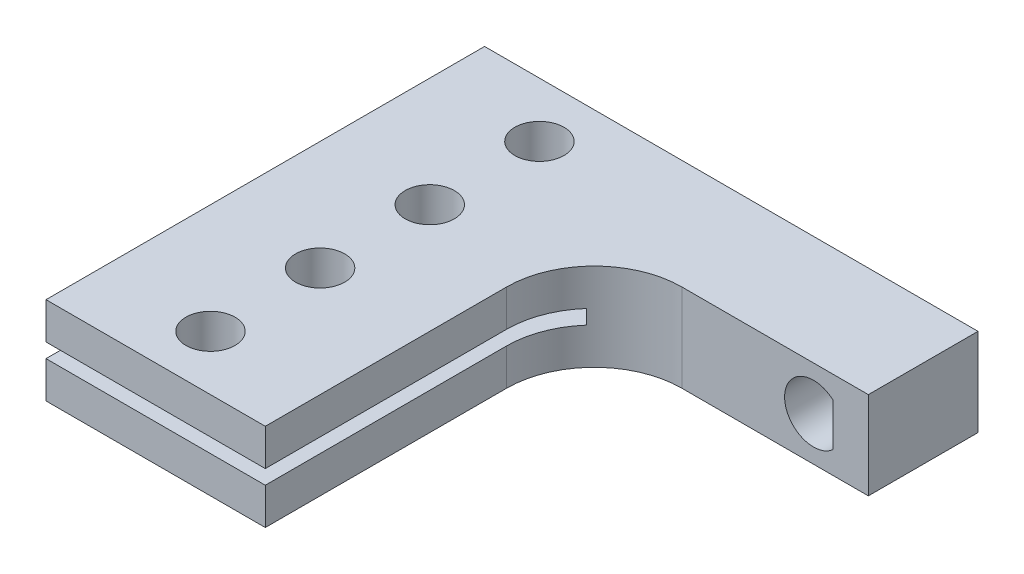
from build123d import *

# Parameters (mm, degrees)
BOSS_EXTRUDE1_DEPTH = 5.08
SKETCH2_W           = 25.4
SKETCH2_H           = 0.8334375
CUT_EXTRUDE1_DEPTH  = 13.97
SKETCH3_R           = 1.4224
CUT_EXTRUDE2_DEPTH  = 12.7
CUT_EXTRUDE3_DEPTH  = 12.7
FILLET3_R           = 5.08


with BuildPart() as part:
    # Sketch1 → Boss-Extrude1 (new body)
    with BuildSketch(Plane(origin=(0, 0, 0), x_dir=(1, 0, 0), z_dir=(0, 1, 0))):
        Polygon((-33.096969697, 5.387878788), (-20.396969697, 5.387878788), (-4.521969697, 5.387878788), (-4.521969697, -0.962121212), (-20.396969697, -0.962121212), (-20.396969697, -20.012121212), (-33.096969697, -20.012121212), align=None)
    extrude(amount=BOSS_EXTRUDE1_DEPTH)

    # Sketch2 → Cut-Extrude1 (cut)
    with BuildSketch(Plane.ZY.offset(33.096969697)):
        with Locations((7.312121212, 2.54)):
            Rectangle(SKETCH2_W, SKETCH2_H)
    extrude(amount=-CUT_EXTRUDE1_DEPTH, mode=Mode.SUBTRACT)

    # Sketch3 → Cut-Extrude2 (cut)
    with BuildSketch(Plane(origin=(0, 5.08, 0), x_dir=(1, 0, 0), z_dir=(0, 1, 0))):
        with Locations(Location((-26.746969697, -16.837121212, 0), (0, 0, 90))):
            Circle(SKETCH3_R)
        with Locations(Location((-26.746969697, -10.487121212, 0), (0, 0, 90))):
            Circle(SKETCH3_R)
        with Locations(Location((-26.746969697, -4.137121212, 0), (0, 0, 90))):
            Circle(SKETCH3_R)
        with Locations(Location((-26.746969697, 2.212878788, 0), (0, 0, 90))):
            Circle(SKETCH3_R)
    extrude(amount=-CUT_EXTRUDE2_DEPTH, mode=Mode.SUBTRACT)

    # Sketch5 → Cut-Extrude3 (cut)
    with BuildSketch(Plane.XY.offset(0.962121212)):
        with BuildLine():
            Line((-6.579369697, 1.290485214), (-6.579369697, 3.789514786))
            ThreePointArc((-6.579369697, 3.789514786), (-9.373369697, 2.54), (-6.579369697, 1.290485214))
        make_face()
    extrude(amount=-CUT_EXTRUDE3_DEPTH, mode=Mode.SUBTRACT)

    # Fillet3
    # the kernel refuses this fillet: 5.08 mm, written as the material it adds along each edge
    with BuildSketch(Plane(origin=(-20.396969697, -9.74328125, 0.962121212), x_dir=(1, 0, 0), z_dir=(0, 1, 0))) as fillet3_piece_1_section:
        with BuildLine():
            CenterArc((FILLET3_R, -FILLET3_R), FILLET3_R, 90, 90)
            Line((0, -FILLET3_R), (0, 0))
            Line((0, 0), (FILLET3_R, 0))
        make_face()
    fillet3_piece_1 = extrude(amount=14.82328125, mode=Mode.PRIVATE)
    fillet3_piece_1 = split(fillet3_piece_1, bisect_by=Plane(origin=(-18.050290176, 0, 1.370319311), z_dir=(0, 1, 0)), keep=Keep.TOP, mode=Mode.PRIVATE)
    fillet3_piece_1 = split(fillet3_piece_1, bisect_by=Plane(origin=(-18.050290176, 2.12328125, 1.370319311), z_dir=(0, -1, 0)), keep=Keep.TOP, mode=Mode.PRIVATE)
    fillet3_piece_1 = split(fillet3_piece_1, bisect_by=Plane(origin=(-19.126969697, 1.061640625, 1.370319311), z_dir=(1, 0, 0)), keep=Keep.TOP, mode=Mode.PRIVATE)
    add(fillet3_piece_1)
    with BuildSketch(Plane(origin=(-20.396969697, -9.74328125, 0.962121212), x_dir=(1, 0, 0), z_dir=(0, 1, 0))) as fillet3_piece_2_section:
        with BuildLine():
            CenterArc((FILLET3_R, -FILLET3_R), FILLET3_R, 90, 90)
            Line((0, -FILLET3_R), (0, 0))
            Line((0, 0), (FILLET3_R, 0))
        make_face()
    fillet3_piece_2 = extrude(amount=14.82328125, mode=Mode.PRIVATE)
    fillet3_piece_2 = split(fillet3_piece_2, bisect_by=Plane(origin=(-19.932991251, 0, 2.537596858), z_dir=(0, 1, 0)), keep=Keep.TOP, mode=Mode.PRIVATE)
    fillet3_piece_2 = split(fillet3_piece_2, bisect_by=Plane(origin=(-19.932991251, 2.12328125, 2.537596858), z_dir=(0, -1, 0)), keep=Keep.TOP, mode=Mode.PRIVATE)
    fillet3_piece_2 = split(fillet3_piece_2, bisect_by=Plane(origin=(-19.126969697, 1.061640625, 2.537596858), z_dir=(-1, 0, 0)), keep=Keep.TOP, mode=Mode.PRIVATE)
    add(fillet3_piece_2)
    with BuildSketch(Plane(origin=(-20.396969697, -9.74328125, 0.962121212), x_dir=(1, 0, 0), z_dir=(0, 1, 0))) as fillet3_piece_3_section:
        with BuildLine():
            CenterArc((FILLET3_R, -FILLET3_R), FILLET3_R, 90, 90)
            Line((0, -FILLET3_R), (0, 0))
            Line((0, 0), (FILLET3_R, 0))
        make_face()
    fillet3_piece_3 = extrude(amount=14.82328125, mode=Mode.PRIVATE)
    fillet3_piece_3 = split(fillet3_piece_3, bisect_by=Plane(origin=(-18.050290176, 2.12328125, 1.370319311), z_dir=(0, 1, 0)), keep=Keep.TOP, mode=Mode.PRIVATE)
    fillet3_piece_3 = split(fillet3_piece_3, bisect_by=Plane(origin=(-19.126969697, 2.54, 1.370319311), z_dir=(1, 0, 0)), keep=Keep.TOP, mode=Mode.PRIVATE)
    fillet3_piece_3 = split(fillet3_piece_3, bisect_by=Plane(origin=(-18.050290176, 2.95671875, 1.370319311), z_dir=(0, -1, 0)), keep=Keep.TOP, mode=Mode.PRIVATE)
    add(fillet3_piece_3)
    with BuildSketch(Plane(origin=(-20.396969697, 2.95671875, 0.962121212), x_dir=(1, 0, 0), z_dir=(0, 1, 0))) as fillet3_piece_4_section:
        with BuildLine():
            CenterArc((FILLET3_R, -FILLET3_R), FILLET3_R, 90, 90)
            Line((0, -FILLET3_R), (0, 0))
            Line((0, 0), (FILLET3_R, 0))
        make_face()
    fillet3_piece_4 = extrude(amount=2.12328125, mode=Mode.PRIVATE)
    fillet3_piece_4 = split(fillet3_piece_4, bisect_by=Plane(origin=(-19.126969697, 4.018359375, 1.370319311), z_dir=(1, 0, 0)), keep=Keep.TOP, mode=Mode.PRIVATE)
    add(fillet3_piece_4)
    with BuildSketch(Plane(origin=(-20.396969697, 2.95671875, 0.962121212), x_dir=(1, 0, 0), z_dir=(0, 1, 0))) as fillet3_piece_5_section:
        with BuildLine():
            CenterArc((FILLET3_R, -FILLET3_R), FILLET3_R, 90, 90)
            Line((0, -FILLET3_R), (0, 0))
            Line((0, 0), (FILLET3_R, 0))
        make_face()
    fillet3_piece_5 = extrude(amount=2.12328125, mode=Mode.PRIVATE)
    fillet3_piece_5 = split(fillet3_piece_5, bisect_by=Plane(origin=(-19.126969697, 4.018359375, 2.537596858), z_dir=(-1, 0, 0)), keep=Keep.TOP, mode=Mode.PRIVATE)
    add(fillet3_piece_5)
    with BuildSketch(Plane(origin=(-20.396969697, 0, 0.962121212), x_dir=(1, 0, 0), z_dir=(0, 1, 0))) as fillet3_piece_6_section:
        with BuildLine():
            CenterArc((FILLET3_R, -FILLET3_R), FILLET3_R, 90, 90)
            Line((0, -FILLET3_R), (0, 0))
            Line((0, 0), (FILLET3_R, 0))
        make_face()
    fillet3_piece_6 = extrude(amount=2.12328125, mode=Mode.PRIVATE)
    fillet3_piece_6 = split(fillet3_piece_6, bisect_by=Plane(origin=(-19.126969697, 1.061640625, 1.370319311), z_dir=(1, 0, 0)), keep=Keep.TOP, mode=Mode.PRIVATE)
    add(fillet3_piece_6)
    with BuildSketch(Plane(origin=(-20.396969697, 0, 0.962121212), x_dir=(1, 0, 0), z_dir=(0, 1, 0))) as fillet3_piece_7_section:
        with BuildLine():
            CenterArc((FILLET3_R, -FILLET3_R), FILLET3_R, 90, 90)
            Line((0, -FILLET3_R), (0, 0))
            Line((0, 0), (FILLET3_R, 0))
        make_face()
    fillet3_piece_7 = extrude(amount=2.12328125, mode=Mode.PRIVATE)
    fillet3_piece_7 = split(fillet3_piece_7, bisect_by=Plane(origin=(-19.126969697, 1.061640625, 2.537596858), z_dir=(-1, 0, 0)), keep=Keep.TOP, mode=Mode.PRIVATE)
    add(fillet3_piece_7)
    with BuildSketch(Plane(origin=(-20.396969697, 0, 0.962121212), x_dir=(1, 0, 0), z_dir=(0, 1, 0))) as fillet3_piece_8_section:
        with BuildLine():
            CenterArc((FILLET3_R, -FILLET3_R), FILLET3_R, 90, 90)
            Line((0, -FILLET3_R), (0, 0))
            Line((0, 0), (FILLET3_R, 0))
        make_face()
    fillet3_piece_8 = extrude(amount=14.82328125, mode=Mode.PRIVATE)
    fillet3_piece_8 = split(fillet3_piece_8, bisect_by=Plane(origin=(-18.050290176, 2.12328125, 1.370319311), z_dir=(0, 1, 0)), keep=Keep.TOP, mode=Mode.PRIVATE)
    fillet3_piece_8 = split(fillet3_piece_8, bisect_by=Plane(origin=(-19.126969697, 2.54, 1.370319311), z_dir=(1, 0, 0)), keep=Keep.TOP, mode=Mode.PRIVATE)
    fillet3_piece_8 = split(fillet3_piece_8, bisect_by=Plane(origin=(-18.050290176, 2.95671875, 1.370319311), z_dir=(0, -1, 0)), keep=Keep.TOP, mode=Mode.PRIVATE)
    add(fillet3_piece_8)
    with BuildSketch(Plane(origin=(-20.396969697, 0, 0.962121212), x_dir=(1, 0, 0), z_dir=(0, 1, 0))) as fillet3_piece_9_section:
        with BuildLine():
            CenterArc((FILLET3_R, -FILLET3_R), FILLET3_R, 90, 90)
            Line((0, -FILLET3_R), (0, 0))
            Line((0, 0), (FILLET3_R, 0))
        make_face()
    fillet3_piece_9 = extrude(amount=14.82328125, mode=Mode.PRIVATE)
    fillet3_piece_9 = split(fillet3_piece_9, bisect_by=Plane(origin=(-18.050290176, 5.08, 1.370319311), z_dir=(0, -1, 0)), keep=Keep.TOP, mode=Mode.PRIVATE)
    fillet3_piece_9 = split(fillet3_piece_9, bisect_by=Plane(origin=(-19.126969697, 4.018359375, 1.370319311), z_dir=(1, 0, 0)), keep=Keep.TOP, mode=Mode.PRIVATE)
    fillet3_piece_9 = split(fillet3_piece_9, bisect_by=Plane(origin=(-18.050290176, 2.95671875, 1.370319311), z_dir=(0, 1, 0)), keep=Keep.TOP, mode=Mode.PRIVATE)
    add(fillet3_piece_9)
    with BuildSketch(Plane(origin=(-20.396969697, 0, 0.962121212), x_dir=(1, 0, 0), z_dir=(0, 1, 0))) as fillet3_piece_10_section:
        with BuildLine():
            CenterArc((FILLET3_R, -FILLET3_R), FILLET3_R, 90, 90)
            Line((0, -FILLET3_R), (0, 0))
            Line((0, 0), (FILLET3_R, 0))
        make_face()
    fillet3_piece_10 = extrude(amount=14.82328125, mode=Mode.PRIVATE)
    fillet3_piece_10 = split(fillet3_piece_10, bisect_by=Plane(origin=(-19.932991251, 5.08, 2.537596858), z_dir=(0, -1, 0)), keep=Keep.TOP, mode=Mode.PRIVATE)
    fillet3_piece_10 = split(fillet3_piece_10, bisect_by=Plane(origin=(-19.126969697, 4.018359375, 2.537596858), z_dir=(-1, 0, 0)), keep=Keep.TOP, mode=Mode.PRIVATE)
    fillet3_piece_10 = split(fillet3_piece_10, bisect_by=Plane(origin=(-19.932991251, 2.95671875, 2.537596858), z_dir=(0, 1, 0)), keep=Keep.TOP, mode=Mode.PRIVATE)
    add(fillet3_piece_10)


solid = part.part
